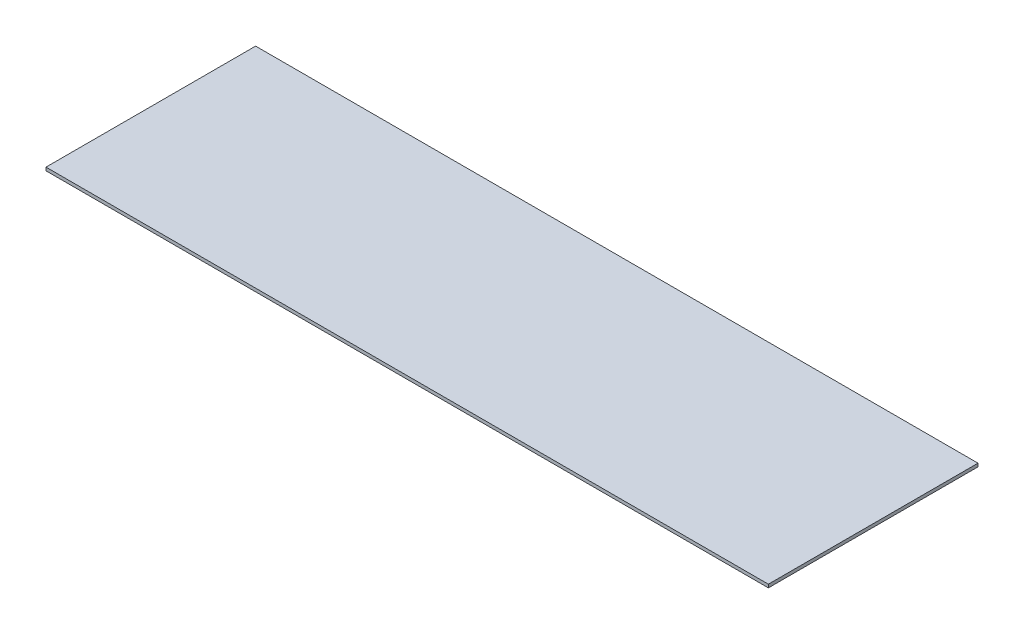
from build123d import *

# Parameters (mm, degrees)
SKETCH1_W          = 103.1875
SKETCH1_H          = 1.5875
BASE_FLANGE1_DEPTH = 355.6


# Sheet-metal steps are written as plain solids
with BuildPart() as part:
    # Sketch1 → Base-Flange1 (new body)
    with BuildSketch(Plane(origin=(0, 0, 0), x_dir=(0, 0, -1), z_dir=(1, 0, 0))):
        with Locations((-51.59375, 0.79375)):
            Rectangle(SKETCH1_W, SKETCH1_H)
    extrude(amount=BASE_FLANGE1_DEPTH)


solid = part.part
